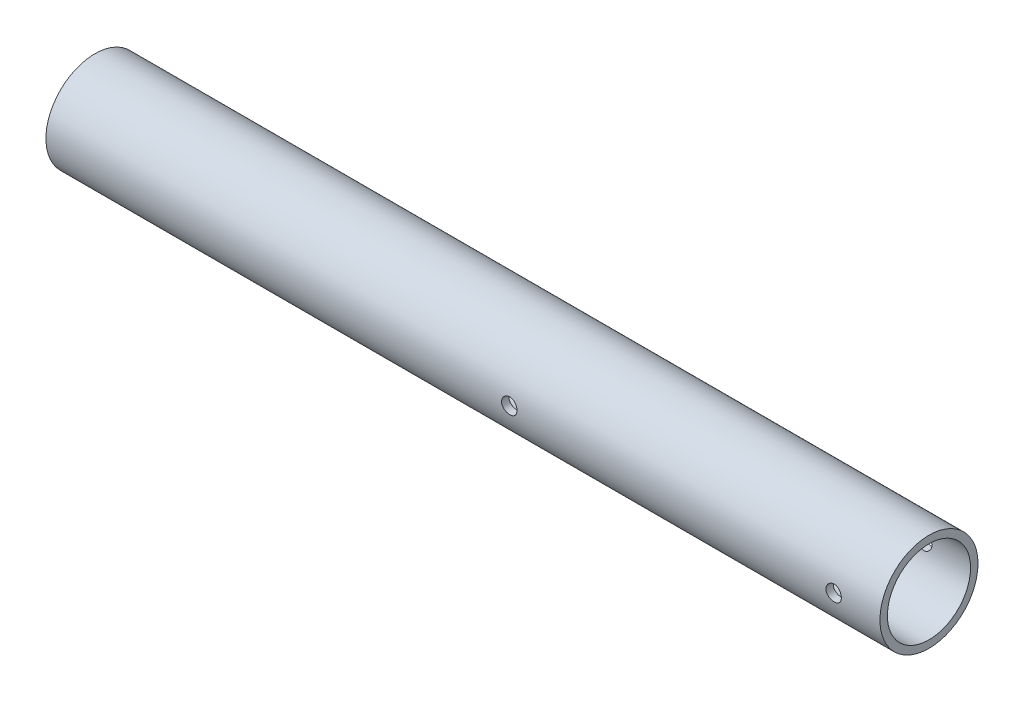
from build123d import *

# Parameters (mm, degrees)
BOSS_EXTRUDE1_DEPTH      = 120
BOSS_EXTRUDE1_DEPTH_BACK = 150
SKETCH1_R                = 15.875
SKETCH1_R_2              = 13.462
CUT_EXTRUDE1_DEPTH       = 150
CUT_EXTRUDE1_DEPTH_BACK  = 150
SKETCH2_R                = 2.5


with BuildPart() as part:
    # Sketch1 → Boss-Extrude1 (new, two sides: drawn at the far end of the back side and taken through both)
    with BuildSketch(Plane(origin=(0, 0, 0), x_dir=(0, 0, -1), z_dir=(1, 0, 0)).offset(-BOSS_EXTRUDE1_DEPTH_BACK)):
        Circle(SKETCH1_R)
        Circle(SKETCH1_R_2, mode=Mode.SUBTRACT)
    extrude(amount=BOSS_EXTRUDE1_DEPTH + BOSS_EXTRUDE1_DEPTH_BACK)

    # Sketch2 → Cut-Extrude1 (cut, two sides: drawn at the far end of the back side and taken through both)
    with BuildSketch(Plane.XY.offset(-CUT_EXTRUDE1_DEPTH_BACK)):
        Circle(SKETCH2_R)
        with Locations((105, 0)):
            Circle(SKETCH2_R)
    extrude(amount=CUT_EXTRUDE1_DEPTH + CUT_EXTRUDE1_DEPTH_BACK, mode=Mode.SUBTRACT)


solid = part.part
